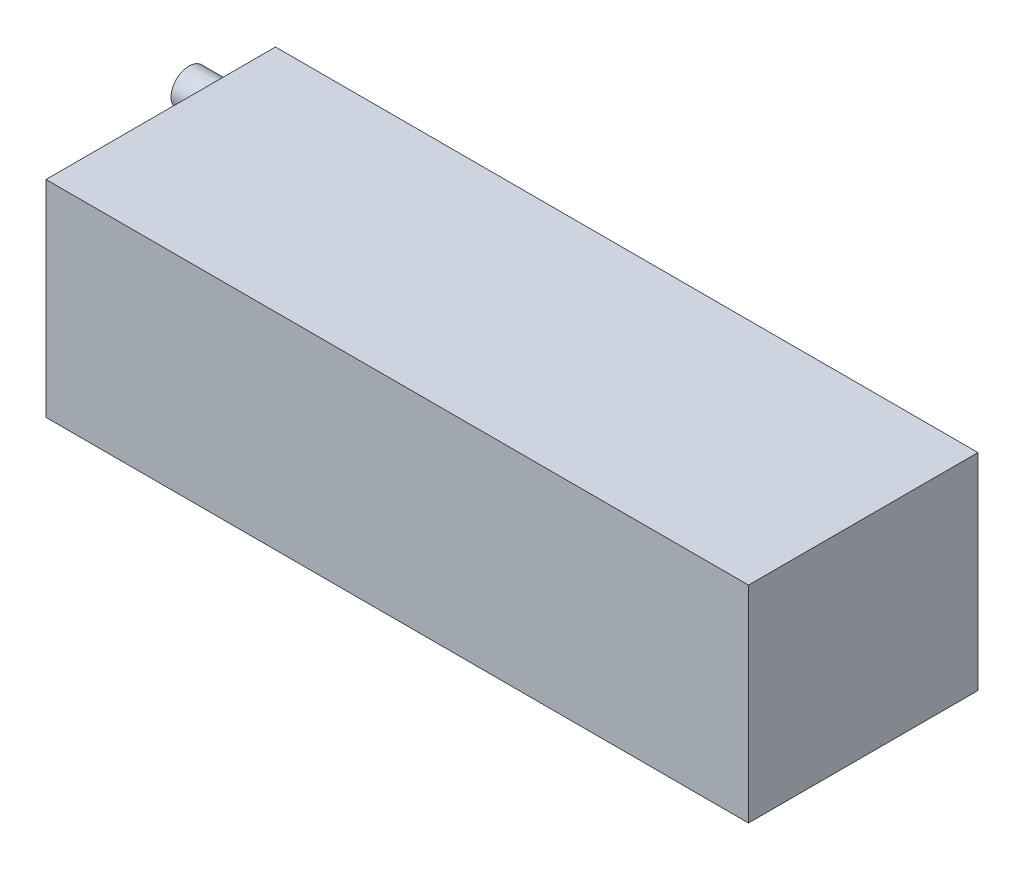
from build123d import *

# Parameters (mm, degrees)
SKETCH1_W             = 150
SKETCH1_H             = 49
BOSS_EXTRUDE1_DEPTH   = 44
SKETCH2_R             = 3.824497405
BOSS_EXTRUDE2_DEPTH   = 10
BOSS_EXTRUDE2_2_DEPTH = 10


with BuildPart() as part:
    # Sketch1 → Boss-Extrude1 (new body)
    with BuildSketch(Plane(origin=(0, 0, 0), x_dir=(1, 0, 0), z_dir=(0, 1, 0))):
        with Locations((75, 24.5)):
            Rectangle(SKETCH1_W, SKETCH1_H)
    extrude(amount=BOSS_EXTRUDE1_DEPTH)


with BuildPart() as body_2:
    # Sketch2 → Boss-Extrude2 (new body)
    with BuildSketch(Plane.ZY):
        with Locations((-40.529448577, 35.886898519)):
            Circle(SKETCH2_R)
    extrude(amount=BOSS_EXTRUDE2_DEPTH)


with BuildPart() as body_3:
    # Sketch2 → Boss-Extrude2 2 (new body)
    with BuildSketch(Plane.ZY):
        with Locations((-40.529448577, 8.906638539)):
            Circle(SKETCH2_R)
    extrude(amount=BOSS_EXTRUDE2_2_DEPTH)


solid = Compound([part.part, body_2.part, body_3.part])
